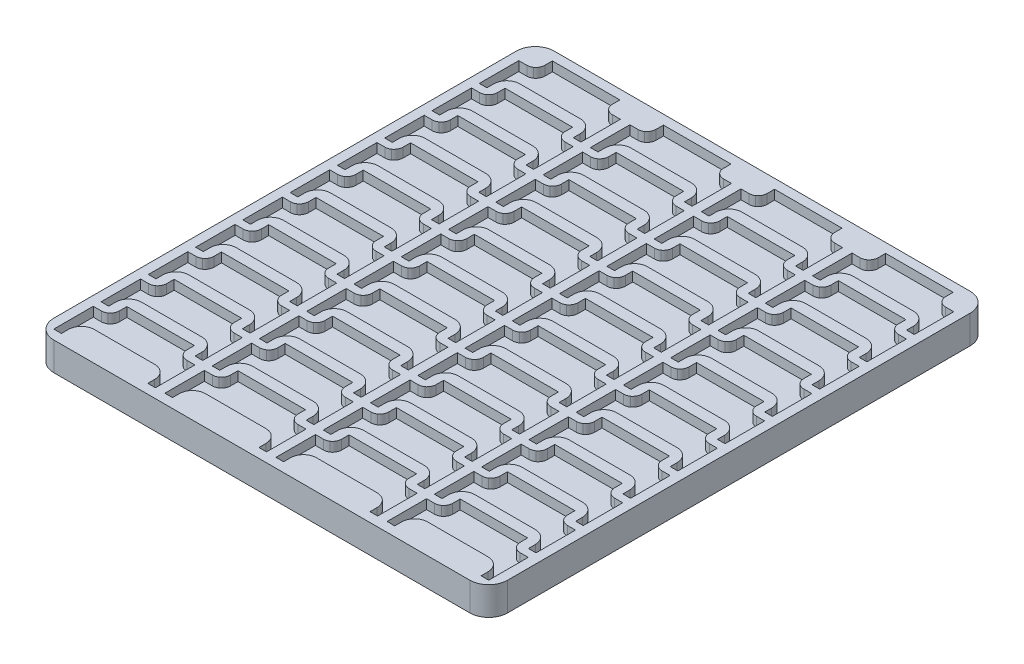
from build123d import *

# Parameters (mm, degrees)
SKETCH1_W           = 96
SKETCH1_H           = 105.85
BOSS_EXTRUDE1_DEPTH = 3
CAVITY1_START       = 1
CAVITY1_DEPTH       = 2
FILLET1_R           = 4


# Read off the part's stored shape, not the designer's step: Cavity1
with BuildPart() as part:
    # Sketch1 → Boss-Extrude1 (new, symmetric)
    with BuildSketch(Plane(origin=(0, 0, 0), x_dir=(1, 0, 0), z_dir=(0, 1, 0))):
        Rectangle(SKETCH1_W, SKETCH1_H)
    extrude(amount=BOSS_EXTRUDE1_DEPTH, both=True)

    # Cavity1 outline → Cavity1 (cut)
    with BuildSketch(Plane(origin=(0, 0, 0), x_dir=(1, 0, 0), z_dir=(0, 1, 0)).offset(CAVITY1_START)):
        with BuildLine():
            Line((5.36, 3.285), (18.14, 3.285))
            ThreePointArc((18.14, 3.285), (20.084543648, 2.479543648), (20.89, 0.535))
            Line((20.89, 0.535), (20.89, -0.925))
            Line((20.89, -0.925), (22.5, -0.925))
            Line((22.5, -0.925), (22.5, 7.428885313))
            Line((22.5, 7.428885313), (20.803324958, 7.428885313))
            ThreePointArc((20.803324958, 7.428885313), (20.233744199, 7.513924788), (19.713842259, 7.761626073))
            ThreePointArc((19.713842259, 7.761626073), (19.108164616, 8.457324711), (18.89, 9.353564747))
            Line((18.89, 9.353564747), (18.89, 10.925))
            Line((18.89, 10.925), (4.61, 10.925))
            Line((4.61, 10.925), (4.61, 9.353564747))
            ThreePointArc((4.61, 9.353564747), (4.391835384, 8.457324711), (3.786157741, 7.761626073))
            ThreePointArc((3.786157741, 7.761626073), (3.266255801, 7.513924788), (2.696675042, 7.428885313))
            Line((2.696675042, 7.428885313), (1, 7.428885313))
            Line((1, 7.428885313), (1, -0.925))
            Line((1, -0.925), (2.61, -0.925))
            Line((2.61, -0.925), (2.61, 0.535))
            ThreePointArc((2.61, 0.535), (3.415456352, 2.479543648), (5.36, 3.285))
        make_face()
        with BuildLine():
            Line((20.89, -39.465), (20.89, -40.925))
            Line((20.89, -40.925), (22.5, -40.925))
            Line((22.5, -40.925), (22.5, -32.571114687))
            Line((22.5, -32.571114687), (20.803324958, -32.571114687))
            ThreePointArc((20.803324958, -32.571114687), (20.233744199, -32.486075212), (19.713842259, -32.238373927))
            ThreePointArc((19.713842259, -32.238373927), (19.108164616, -31.542675289), (18.89, -30.646435253))
            Line((18.89, -30.646435253), (18.89, -29.075))
            Line((18.89, -29.075), (4.61, -29.075))
            Line((4.61, -29.075), (4.61, -30.646435253))
            ThreePointArc((4.61, -30.646435253), (4.391835384, -31.542675289), (3.786157741, -32.238373927))
            ThreePointArc((3.786157741, -32.238373927), (3.266255801, -32.486075212), (2.696675042, -32.571114687))
            Line((2.696675042, -32.571114687), (1, -32.571114687))
            Line((1, -32.571114687), (1, -40.925))
            Line((1, -40.925), (2.61, -40.925))
            Line((2.61, -40.925), (2.61, -39.465))
            ThreePointArc((2.61, -39.465), (3.415456352, -37.520456352), (5.36, -36.715))
            Line((5.36, -36.715), (18.14, -36.715))
            ThreePointArc((18.14, -36.715), (20.084543648, -37.520456352), (20.89, -39.465))
        make_face()
        with BuildLine():
            Line((20.89, -49.465), (20.89, -50.925))
            Line((20.89, -50.925), (22.5, -50.925))
            Line((22.5, -50.925), (22.5, -42.571114687))
            Line((22.5, -42.571114687), (20.803324958, -42.571114687))
            ThreePointArc((20.803324958, -42.571114687), (20.233744199, -42.486075212), (19.713842259, -42.238373927))
            ThreePointArc((19.713842259, -42.238373927), (19.108164616, -41.542675289), (18.89, -40.646435253))
            Line((18.89, -40.646435253), (18.89, -39.075))
            Line((18.89, -39.075), (4.61, -39.075))
            Line((4.61, -39.075), (4.61, -40.646435253))
            ThreePointArc((4.61, -40.646435253), (4.391835384, -41.542675289), (3.786157741, -42.238373927))
            ThreePointArc((3.786157741, -42.238373927), (3.266255801, -42.486075212), (2.696675042, -42.571114687))
            Line((2.696675042, -42.571114687), (1, -42.571114687))
            Line((1, -42.571114687), (1, -50.925))
            Line((1, -50.925), (2.61, -50.925))
            Line((2.61, -50.925), (2.61, -49.465))
            ThreePointArc((2.61, -49.465), (3.415456352, -47.520456352), (5.36, -46.715))
            Line((5.36, -46.715), (18.14, -46.715))
            ThreePointArc((18.14, -46.715), (20.084543648, -47.520456352), (20.89, -49.465))
        make_face()
        with BuildLine():
            Line((20.89, 40.535), (20.89, 39.075))
            Line((20.89, 39.075), (22.5, 39.075))
            Line((22.5, 39.075), (22.5, 47.428885313))
            Line((22.5, 47.428885313), (20.803324958, 47.428885313))
            ThreePointArc((20.803324958, 47.428885313), (20.233744199, 47.513924788), (19.713842259, 47.761626073))
            ThreePointArc((19.713842259, 47.761626073), (19.108164616, 48.457324711), (18.89, 49.353564747))
            Line((18.89, 49.353564747), (18.89, 50.925))
            Line((18.89, 50.925), (4.61, 50.925))
            Line((4.61, 50.925), (4.61, 49.353564747))
            ThreePointArc((4.61, 49.353564747), (4.391835384, 48.457324711), (3.786157741, 47.761626073))
            ThreePointArc((3.786157741, 47.761626073), (3.266255801, 47.513924788), (2.696675042, 47.428885313))
            Line((2.696675042, 47.428885313), (1, 47.428885313))
            Line((1, 47.428885313), (1, 39.075))
            Line((1, 39.075), (2.61, 39.075))
            Line((2.61, 39.075), (2.61, 40.535))
            ThreePointArc((2.61, 40.535), (3.415456352, 42.479543648), (5.36, 43.285))
            Line((5.36, 43.285), (18.14, 43.285))
            ThreePointArc((18.14, 43.285), (20.084543648, 42.479543648), (20.89, 40.535))
        make_face()
        with BuildLine():
            Line((20.89, 10.535), (20.89, 9.075))
            Line((20.89, 9.075), (22.5, 9.075))
            Line((22.5, 9.075), (22.5, 17.428885313))
            Line((22.5, 17.428885313), (20.803324958, 17.428885313))
            ThreePointArc((20.803324958, 17.428885313), (20.233744199, 17.513924788), (19.713842259, 17.761626073))
            ThreePointArc((19.713842259, 17.761626073), (19.108164616, 18.457324711), (18.89, 19.353564747))
            Line((18.89, 19.353564747), (18.89, 20.925))
            Line((18.89, 20.925), (4.61, 20.925))
            Line((4.61, 20.925), (4.61, 19.353564747))
            ThreePointArc((4.61, 19.353564747), (4.391835384, 18.457324711), (3.786157741, 17.761626073))
            ThreePointArc((3.786157741, 17.761626073), (3.266255801, 17.513924788), (2.696675042, 17.428885313))
            Line((2.696675042, 17.428885313), (1, 17.428885313))
            Line((1, 17.428885313), (1, 9.075))
            Line((1, 9.075), (2.61, 9.075))
            Line((2.61, 9.075), (2.61, 10.535))
            ThreePointArc((2.61, 10.535), (3.415456352, 12.479543648), (5.36, 13.285))
            Line((5.36, 13.285), (18.14, 13.285))
            ThreePointArc((18.14, 13.285), (20.084543648, 12.479543648), (20.89, 10.535))
        make_face()
        with BuildLine():
            Line((20.89, -9.465), (20.89, -10.925))
            Line((20.89, -10.925), (22.5, -10.925))
            Line((22.5, -10.925), (22.5, -2.571114687))
            Line((22.5, -2.571114687), (20.803324958, -2.571114687))
            ThreePointArc((20.803324958, -2.571114687), (20.233744199, -2.486075212), (19.713842259, -2.238373927))
            ThreePointArc((19.713842259, -2.238373927), (19.108164616, -1.542675289), (18.89, -0.646435253))
            Line((18.89, -0.646435253), (18.89, 0.925))
            Line((18.89, 0.925), (4.61, 0.925))
            Line((4.61, 0.925), (4.61, -0.646435253))
            ThreePointArc((4.61, -0.646435253), (4.391835384, -1.542675289), (3.786157741, -2.238373927))
            ThreePointArc((3.786157741, -2.238373927), (3.266255801, -2.486075212), (2.696675042, -2.571114687))
            Line((2.696675042, -2.571114687), (1, -2.571114687))
            Line((1, -2.571114687), (1, -10.925))
            Line((1, -10.925), (2.61, -10.925))
            Line((2.61, -10.925), (2.61, -9.465))
            ThreePointArc((2.61, -9.465), (3.415456352, -7.520456352), (5.36, -6.715))
            Line((5.36, -6.715), (18.14, -6.715))
            ThreePointArc((18.14, -6.715), (20.084543648, -7.520456352), (20.89, -9.465))
        make_face()
        with BuildLine():
            Line((20.89, -29.465), (20.89, -30.925))
            Line((20.89, -30.925), (22.5, -30.925))
            Line((22.5, -30.925), (22.5, -22.571114687))
            Line((22.5, -22.571114687), (20.803324958, -22.571114687))
            ThreePointArc((20.803324958, -22.571114687), (20.233744199, -22.486075212), (19.713842259, -22.238373927))
            ThreePointArc((19.713842259, -22.238373927), (19.108164616, -21.542675289), (18.89, -20.646435253))
            Line((18.89, -20.646435253), (18.89, -19.075))
            Line((18.89, -19.075), (4.61, -19.075))
            Line((4.61, -19.075), (4.61, -20.646435253))
            ThreePointArc((4.61, -20.646435253), (4.391835384, -21.542675289), (3.786157741, -22.238373927))
            ThreePointArc((3.786157741, -22.238373927), (3.266255801, -22.486075212), (2.696675042, -22.571114687))
            Line((2.696675042, -22.571114687), (1, -22.571114687))
            Line((1, -22.571114687), (1, -30.925))
            Line((1, -30.925), (2.61, -30.925))
            Line((2.61, -30.925), (2.61, -29.465))
            ThreePointArc((2.61, -29.465), (3.415456352, -27.520456352), (5.36, -26.715))
            Line((5.36, -26.715), (18.14, -26.715))
            ThreePointArc((18.14, -26.715), (20.084543648, -27.520456352), (20.89, -29.465))
        make_face()
        with BuildLine():
            Line((20.89, -19.465), (20.89, -20.925))
            Line((20.89, -20.925), (22.5, -20.925))
            Line((22.5, -20.925), (22.5, -12.571114687))
            Line((22.5, -12.571114687), (20.803324958, -12.571114687))
            ThreePointArc((20.803324958, -12.571114687), (20.233744199, -12.486075212), (19.713842259, -12.238373927))
            ThreePointArc((19.713842259, -12.238373927), (19.108164616, -11.542675289), (18.89, -10.646435253))
            Line((18.89, -10.646435253), (18.89, -9.075))
            Line((18.89, -9.075), (4.61, -9.075))
            Line((4.61, -9.075), (4.61, -10.646435253))
            ThreePointArc((4.61, -10.646435253), (4.391835384, -11.542675289), (3.786157741, -12.238373927))
            ThreePointArc((3.786157741, -12.238373927), (3.266255801, -12.486075212), (2.696675042, -12.571114687))
            Line((2.696675042, -12.571114687), (1, -12.571114687))
            Line((1, -12.571114687), (1, -20.925))
            Line((1, -20.925), (2.61, -20.925))
            Line((2.61, -20.925), (2.61, -19.465))
            ThreePointArc((2.61, -19.465), (3.415456352, -17.520456352), (5.36, -16.715))
            Line((5.36, -16.715), (18.14, -16.715))
            ThreePointArc((18.14, -16.715), (20.084543648, -17.520456352), (20.89, -19.465))
        make_face()
        with BuildLine():
            Line((20.89, 30.535), (20.89, 29.075))
            Line((20.89, 29.075), (22.5, 29.075))
            Line((22.5, 29.075), (22.5, 37.428885313))
            Line((22.5, 37.428885313), (20.803324958, 37.428885313))
            ThreePointArc((20.803324958, 37.428885313), (20.233744199, 37.513924788), (19.713842259, 37.761626073))
            ThreePointArc((19.713842259, 37.761626073), (19.108164616, 38.457324711), (18.89, 39.353564747))
            Line((18.89, 39.353564747), (18.89, 40.925))
            Line((18.89, 40.925), (4.61, 40.925))
            Line((4.61, 40.925), (4.61, 39.353564747))
            ThreePointArc((4.61, 39.353564747), (4.391835384, 38.457324711), (3.786157741, 37.761626073))
            ThreePointArc((3.786157741, 37.761626073), (3.266255801, 37.513924788), (2.696675042, 37.428885313))
            Line((2.696675042, 37.428885313), (1, 37.428885313))
            Line((1, 37.428885313), (1, 29.075))
            Line((1, 29.075), (2.61, 29.075))
            Line((2.61, 29.075), (2.61, 30.535))
            ThreePointArc((2.61, 30.535), (3.415456352, 32.479543648), (5.36, 33.285))
            Line((5.36, 33.285), (18.14, 33.285))
            ThreePointArc((18.14, 33.285), (20.084543648, 32.479543648), (20.89, 30.535))
        make_face()
        with BuildLine():
            Line((20.89, 20.535), (20.89, 19.075))
            Line((20.89, 19.075), (22.5, 19.075))
            Line((22.5, 19.075), (22.5, 27.428885313))
            Line((22.5, 27.428885313), (20.803324958, 27.428885313))
            ThreePointArc((20.803324958, 27.428885313), (20.233744199, 27.513924788), (19.713842259, 27.761626073))
            ThreePointArc((19.713842259, 27.761626073), (19.108164616, 28.457324711), (18.89, 29.353564747))
            Line((18.89, 29.353564747), (18.89, 30.925))
            Line((18.89, 30.925), (4.61, 30.925))
            Line((4.61, 30.925), (4.61, 29.353564747))
            ThreePointArc((4.61, 29.353564747), (4.391835384, 28.457324711), (3.786157741, 27.761626073))
            ThreePointArc((3.786157741, 27.761626073), (3.266255801, 27.513924788), (2.696675042, 27.428885313))
            Line((2.696675042, 27.428885313), (1, 27.428885313))
            Line((1, 27.428885313), (1, 19.075))
            Line((1, 19.075), (2.61, 19.075))
            Line((2.61, 19.075), (2.61, 20.535))
            ThreePointArc((2.61, 20.535), (3.415456352, 22.479543648), (5.36, 23.285))
            Line((5.36, 23.285), (18.14, 23.285))
            ThreePointArc((18.14, 23.285), (20.084543648, 22.479543648), (20.89, 20.535))
        make_face()
        with BuildLine():
            Line((44.39, -0.925), (46, -0.925))
            Line((46, -0.925), (46, 7.428885313))
            Line((46, 7.428885313), (44.303324958, 7.428885313))
            ThreePointArc((44.303324958, 7.428885313), (43.733744199, 7.513924788), (43.213842259, 7.761626073))
            ThreePointArc((43.213842259, 7.761626073), (42.608164616, 8.457324711), (42.39, 9.353564747))
            Line((42.39, 9.353564747), (42.39, 10.925))
            Line((42.39, 10.925), (28.11, 10.925))
            Line((28.11, 10.925), (28.11, 9.353564747))
            ThreePointArc((28.11, 9.353564747), (27.891835384, 8.457324711), (27.286157741, 7.761626073))
            ThreePointArc((27.286157741, 7.761626073), (26.766255801, 7.513924788), (26.196675042, 7.428885313))
            Line((26.196675042, 7.428885313), (24.5, 7.428885313))
            Line((24.5, 7.428885313), (24.5, -0.925))
            Line((24.5, -0.925), (26.11, -0.925))
            Line((26.11, -0.925), (26.11, 0.535))
            ThreePointArc((26.11, 0.535), (26.915456352, 2.479543648), (28.86, 3.285))
            Line((28.86, 3.285), (41.64, 3.285))
            ThreePointArc((41.64, 3.285), (43.584543648, 2.479543648), (44.39, 0.535))
            Line((44.39, 0.535), (44.39, -0.925))
        make_face()
        with BuildLine():
            Line((-26.11, -0.925), (-24.5, -0.925))
            Line((-24.5, -0.925), (-24.5, 7.428885313))
            Line((-24.5, 7.428885313), (-26.196675042, 7.428885313))
            ThreePointArc((-26.196675042, 7.428885313), (-26.766255801, 7.513924788), (-27.286157741, 7.761626073))
            ThreePointArc((-27.286157741, 7.761626073), (-27.891835384, 8.457324711), (-28.11, 9.353564747))
            Line((-28.11, 9.353564747), (-28.11, 10.925))
            Line((-28.11, 10.925), (-42.39, 10.925))
            Line((-42.39, 10.925), (-42.39, 9.353564747))
            ThreePointArc((-42.39, 9.353564747), (-42.608164616, 8.457324711), (-43.213842259, 7.761626073))
            ThreePointArc((-43.213842259, 7.761626073), (-43.733744199, 7.513924788), (-44.303324958, 7.428885313))
            Line((-44.303324958, 7.428885313), (-46, 7.428885313))
            Line((-46, 7.428885313), (-46, -0.925))
            Line((-46, -0.925), (-44.39, -0.925))
            Line((-44.39, -0.925), (-44.39, 0.535))
            ThreePointArc((-44.39, 0.535), (-43.584543648, 2.479543648), (-41.64, 3.285))
            Line((-41.64, 3.285), (-28.86, 3.285))
            ThreePointArc((-28.86, 3.285), (-26.915456352, 2.479543648), (-26.11, 0.535))
            Line((-26.11, 0.535), (-26.11, -0.925))
        make_face()
        with BuildLine():
            Line((-2.61, -0.925), (-1, -0.925))
            Line((-1, -0.925), (-1, 7.428885313))
            Line((-1, 7.428885313), (-2.696675042, 7.428885313))
            ThreePointArc((-2.696675042, 7.428885313), (-3.266255801, 7.513924788), (-3.786157741, 7.761626073))
            ThreePointArc((-3.786157741, 7.761626073), (-4.391835384, 8.457324711), (-4.61, 9.353564747))
            Line((-4.61, 9.353564747), (-4.61, 10.925))
            Line((-4.61, 10.925), (-18.89, 10.925))
            Line((-18.89, 10.925), (-18.89, 9.353564747))
            ThreePointArc((-18.89, 9.353564747), (-19.108164616, 8.457324711), (-19.713842259, 7.761626073))
            ThreePointArc((-19.713842259, 7.761626073), (-20.233744199, 7.513924788), (-20.803324958, 7.428885313))
            Line((-20.803324958, 7.428885313), (-22.5, 7.428885313))
            Line((-22.5, 7.428885313), (-22.5, -0.925))
            Line((-22.5, -0.925), (-20.89, -0.925))
            Line((-20.89, -0.925), (-20.89, 0.535))
            ThreePointArc((-20.89, 0.535), (-20.084543648, 2.479543648), (-18.14, 3.285))
            Line((-18.14, 3.285), (-5.36, 3.285))
            ThreePointArc((-5.36, 3.285), (-3.415456352, 2.479543648), (-2.61, 0.535))
            Line((-2.61, 0.535), (-2.61, -0.925))
        make_face()
        with BuildLine():
            Line((-26.11, -40.925), (-24.5, -40.925))
            Line((-24.5, -40.925), (-24.5, -32.571114687))
            Line((-24.5, -32.571114687), (-26.196675042, -32.571114687))
            ThreePointArc((-26.196675042, -32.571114687), (-26.766255801, -32.486075212), (-27.286157741, -32.238373927))
            ThreePointArc((-27.286157741, -32.238373927), (-27.891835384, -31.542675289), (-28.11, -30.646435253))
            Line((-28.11, -30.646435253), (-28.11, -29.075))
            Line((-28.11, -29.075), (-42.39, -29.075))
            Line((-42.39, -29.075), (-42.39, -30.646435253))
            ThreePointArc((-42.39, -30.646435253), (-42.608164616, -31.542675289), (-43.213842259, -32.238373927))
            ThreePointArc((-43.213842259, -32.238373927), (-43.733744199, -32.486075212), (-44.303324958, -32.571114687))
            Line((-44.303324958, -32.571114687), (-46, -32.571114687))
            Line((-46, -32.571114687), (-46, -40.925))
            Line((-46, -40.925), (-44.39, -40.925))
            Line((-44.39, -40.925), (-44.39, -39.465))
            ThreePointArc((-44.39, -39.465), (-43.584543648, -37.520456352), (-41.64, -36.715))
            Line((-41.64, -36.715), (-28.86, -36.715))
            ThreePointArc((-28.86, -36.715), (-26.915456352, -37.520456352), (-26.11, -39.465))
            Line((-26.11, -39.465), (-26.11, -40.925))
        make_face()
        with BuildLine():
            Line((-2.61, -40.925), (-1, -40.925))
            Line((-1, -40.925), (-1, -32.571114687))
            Line((-1, -32.571114687), (-2.696675042, -32.571114687))
            ThreePointArc((-2.696675042, -32.571114687), (-3.266255801, -32.486075212), (-3.786157741, -32.238373927))
            ThreePointArc((-3.786157741, -32.238373927), (-4.391835384, -31.542675289), (-4.61, -30.646435253))
            Line((-4.61, -30.646435253), (-4.61, -29.075))
            Line((-4.61, -29.075), (-18.89, -29.075))
            Line((-18.89, -29.075), (-18.89, -30.646435253))
            ThreePointArc((-18.89, -30.646435253), (-19.108164616, -31.542675289), (-19.713842259, -32.238373927))
            ThreePointArc((-19.713842259, -32.238373927), (-20.233744199, -32.486075212), (-20.803324958, -32.571114687))
            Line((-20.803324958, -32.571114687), (-22.5, -32.571114687))
            Line((-22.5, -32.571114687), (-22.5, -40.925))
            Line((-22.5, -40.925), (-20.89, -40.925))
            Line((-20.89, -40.925), (-20.89, -39.465))
            ThreePointArc((-20.89, -39.465), (-20.084543648, -37.520456352), (-18.14, -36.715))
            Line((-18.14, -36.715), (-5.36, -36.715))
            ThreePointArc((-5.36, -36.715), (-3.415456352, -37.520456352), (-2.61, -39.465))
            Line((-2.61, -39.465), (-2.61, -40.925))
        make_face()
        with BuildLine():
            Line((44.39, -40.925), (46, -40.925))
            Line((46, -40.925), (46, -32.571114687))
            Line((46, -32.571114687), (44.303324958, -32.571114687))
            ThreePointArc((44.303324958, -32.571114687), (43.733744199, -32.486075212), (43.213842259, -32.238373927))
            ThreePointArc((43.213842259, -32.238373927), (42.608164616, -31.542675289), (42.39, -30.646435253))
            Line((42.39, -30.646435253), (42.39, -29.075))
            Line((42.39, -29.075), (28.11, -29.075))
            Line((28.11, -29.075), (28.11, -30.646435253))
            ThreePointArc((28.11, -30.646435253), (27.891835384, -31.542675289), (27.286157741, -32.238373927))
            ThreePointArc((27.286157741, -32.238373927), (26.766255801, -32.486075212), (26.196675042, -32.571114687))
            Line((26.196675042, -32.571114687), (24.5, -32.571114687))
            Line((24.5, -32.571114687), (24.5, -40.925))
            Line((24.5, -40.925), (26.11, -40.925))
            Line((26.11, -40.925), (26.11, -39.465))
            ThreePointArc((26.11, -39.465), (26.915456352, -37.520456352), (28.86, -36.715))
            Line((28.86, -36.715), (41.64, -36.715))
            ThreePointArc((41.64, -36.715), (43.584543648, -37.520456352), (44.39, -39.465))
            Line((44.39, -39.465), (44.39, -40.925))
        make_face()
        with BuildLine():
            Line((-26.11, -50.925), (-24.5, -50.925))
            Line((-24.5, -50.925), (-24.5, -42.571114687))
            Line((-24.5, -42.571114687), (-26.196675042, -42.571114687))
            ThreePointArc((-26.196675042, -42.571114687), (-26.766255801, -42.486075212), (-27.286157741, -42.238373927))
            ThreePointArc((-27.286157741, -42.238373927), (-27.891835384, -41.542675289), (-28.11, -40.646435253))
            Line((-28.11, -40.646435253), (-28.11, -39.075))
            Line((-28.11, -39.075), (-42.39, -39.075))
            Line((-42.39, -39.075), (-42.39, -40.646435253))
            ThreePointArc((-42.39, -40.646435253), (-42.608164616, -41.542675289), (-43.213842259, -42.238373927))
            ThreePointArc((-43.213842259, -42.238373927), (-43.733744199, -42.486075212), (-44.303324958, -42.571114687))
            Line((-44.303324958, -42.571114687), (-46, -42.571114687))
            Line((-46, -42.571114687), (-46, -50.925))
            Line((-46, -50.925), (-44.39, -50.925))
            Line((-44.39, -50.925), (-44.39, -49.465))
            ThreePointArc((-44.39, -49.465), (-43.584543648, -47.520456352), (-41.64, -46.715))
            Line((-41.64, -46.715), (-28.86, -46.715))
            ThreePointArc((-28.86, -46.715), (-26.915456352, -47.520456352), (-26.11, -49.465))
            Line((-26.11, -49.465), (-26.11, -50.925))
        make_face()
        with BuildLine():
            Line((-2.61, -50.925), (-1, -50.925))
            Line((-1, -50.925), (-1, -42.571114687))
            Line((-1, -42.571114687), (-2.696675042, -42.571114687))
            ThreePointArc((-2.696675042, -42.571114687), (-3.266255801, -42.486075212), (-3.786157741, -42.238373927))
            ThreePointArc((-3.786157741, -42.238373927), (-4.391835384, -41.542675289), (-4.61, -40.646435253))
            Line((-4.61, -40.646435253), (-4.61, -39.075))
            Line((-4.61, -39.075), (-18.89, -39.075))
            Line((-18.89, -39.075), (-18.89, -40.646435253))
            ThreePointArc((-18.89, -40.646435253), (-19.108164616, -41.542675289), (-19.713842259, -42.238373927))
            ThreePointArc((-19.713842259, -42.238373927), (-20.233744199, -42.486075212), (-20.803324958, -42.571114687))
            Line((-20.803324958, -42.571114687), (-22.5, -42.571114687))
            Line((-22.5, -42.571114687), (-22.5, -50.925))
            Line((-22.5, -50.925), (-20.89, -50.925))
            Line((-20.89, -50.925), (-20.89, -49.465))
            ThreePointArc((-20.89, -49.465), (-20.084543648, -47.520456352), (-18.14, -46.715))
            Line((-18.14, -46.715), (-5.36, -46.715))
            ThreePointArc((-5.36, -46.715), (-3.415456352, -47.520456352), (-2.61, -49.465))
            Line((-2.61, -49.465), (-2.61, -50.925))
        make_face()
        with BuildLine():
            Line((44.39, -50.925), (46, -50.925))
            Line((46, -50.925), (46, -42.571114687))
            Line((46, -42.571114687), (44.303324958, -42.571114687))
            ThreePointArc((44.303324958, -42.571114687), (43.733744199, -42.486075212), (43.213842259, -42.238373927))
            ThreePointArc((43.213842259, -42.238373927), (42.608164616, -41.542675289), (42.39, -40.646435253))
            Line((42.39, -40.646435253), (42.39, -39.075))
            Line((42.39, -39.075), (28.11, -39.075))
            Line((28.11, -39.075), (28.11, -40.646435253))
            ThreePointArc((28.11, -40.646435253), (27.891835384, -41.542675289), (27.286157741, -42.238373927))
            ThreePointArc((27.286157741, -42.238373927), (26.766255801, -42.486075212), (26.196675042, -42.571114687))
            Line((26.196675042, -42.571114687), (24.5, -42.571114687))
            Line((24.5, -42.571114687), (24.5, -50.925))
            Line((24.5, -50.925), (26.11, -50.925))
            Line((26.11, -50.925), (26.11, -49.465))
            ThreePointArc((26.11, -49.465), (26.915456352, -47.520456352), (28.86, -46.715))
            Line((28.86, -46.715), (41.64, -46.715))
            ThreePointArc((41.64, -46.715), (43.584543648, -47.520456352), (44.39, -49.465))
            Line((44.39, -49.465), (44.39, -50.925))
        make_face()
        with BuildLine():
            Line((-18.14, -6.715), (-5.36, -6.715))
            ThreePointArc((-5.36, -6.715), (-3.415456352, -7.520456352), (-2.61, -9.465))
            Line((-2.61, -9.465), (-2.61, -10.925))
            Line((-2.61, -10.925), (-1, -10.925))
            Line((-1, -10.925), (-1, -2.571114687))
            Line((-1, -2.571114687), (-2.696675042, -2.571114687))
            ThreePointArc((-2.696675042, -2.571114687), (-3.266255801, -2.486075212), (-3.786157741, -2.238373927))
            ThreePointArc((-3.786157741, -2.238373927), (-4.391835384, -1.542675289), (-4.61, -0.646435253))
            Line((-4.61, -0.646435253), (-4.61, 0.925))
            Line((-4.61, 0.925), (-18.89, 0.925))
            Line((-18.89, 0.925), (-18.89, -0.646435253))
            ThreePointArc((-18.89, -0.646435253), (-19.108164616, -1.542675289), (-19.713842259, -2.238373927))
            ThreePointArc((-19.713842259, -2.238373927), (-20.233744199, -2.486075212), (-20.803324958, -2.571114687))
            Line((-20.803324958, -2.571114687), (-22.5, -2.571114687))
            Line((-22.5, -2.571114687), (-22.5, -10.925))
            Line((-22.5, -10.925), (-20.89, -10.925))
            Line((-20.89, -10.925), (-20.89, -9.465))
            ThreePointArc((-20.89, -9.465), (-20.084543648, -7.520456352), (-18.14, -6.715))
        make_face()
        with BuildLine():
            Line((-2.61, 40.535), (-2.61, 39.075))
            Line((-2.61, 39.075), (-1, 39.075))
            Line((-1, 39.075), (-1, 47.428885313))
            Line((-1, 47.428885313), (-2.696675042, 47.428885313))
            ThreePointArc((-2.696675042, 47.428885313), (-3.266255801, 47.513924788), (-3.786157741, 47.761626073))
            ThreePointArc((-3.786157741, 47.761626073), (-4.391835384, 48.457324711), (-4.61, 49.353564747))
            Line((-4.61, 49.353564747), (-4.61, 50.925))
            Line((-4.61, 50.925), (-18.89, 50.925))
            Line((-18.89, 50.925), (-18.89, 49.353564747))
            ThreePointArc((-18.89, 49.353564747), (-19.108164616, 48.457324711), (-19.713842259, 47.761626073))
            ThreePointArc((-19.713842259, 47.761626073), (-20.233744199, 47.513924788), (-20.803324958, 47.428885313))
            Line((-20.803324958, 47.428885313), (-22.5, 47.428885313))
            Line((-22.5, 47.428885313), (-22.5, 39.075))
            Line((-22.5, 39.075), (-20.89, 39.075))
            Line((-20.89, 39.075), (-20.89, 40.535))
            ThreePointArc((-20.89, 40.535), (-20.084543648, 42.479543648), (-18.14, 43.285))
            Line((-18.14, 43.285), (-5.36, 43.285))
            ThreePointArc((-5.36, 43.285), (-3.415456352, 42.479543648), (-2.61, 40.535))
        make_face()
        with BuildLine():
            Line((-2.61, 10.535), (-2.61, 9.075))
            Line((-2.61, 9.075), (-1, 9.075))
            Line((-1, 9.075), (-1, 17.428885313))
            Line((-1, 17.428885313), (-2.696675042, 17.428885313))
            ThreePointArc((-2.696675042, 17.428885313), (-3.266255801, 17.513924788), (-3.786157741, 17.761626073))
            ThreePointArc((-3.786157741, 17.761626073), (-4.391835384, 18.457324711), (-4.61, 19.353564747))
            Line((-4.61, 19.353564747), (-4.61, 20.925))
            Line((-4.61, 20.925), (-18.89, 20.925))
            Line((-18.89, 20.925), (-18.89, 19.353564747))
            ThreePointArc((-18.89, 19.353564747), (-19.108164616, 18.457324711), (-19.713842259, 17.761626073))
            ThreePointArc((-19.713842259, 17.761626073), (-20.233744199, 17.513924788), (-20.803324958, 17.428885313))
            Line((-20.803324958, 17.428885313), (-22.5, 17.428885313))
            Line((-22.5, 17.428885313), (-22.5, 9.075))
            Line((-22.5, 9.075), (-20.89, 9.075))
            Line((-20.89, 9.075), (-20.89, 10.535))
            ThreePointArc((-20.89, 10.535), (-20.084543648, 12.479543648), (-18.14, 13.285))
            Line((-18.14, 13.285), (-5.36, 13.285))
            ThreePointArc((-5.36, 13.285), (-3.415456352, 12.479543648), (-2.61, 10.535))
        make_face()
        with BuildLine():
            Line((-2.61, -29.465), (-2.61, -30.925))
            Line((-2.61, -30.925), (-1, -30.925))
            Line((-1, -30.925), (-1, -22.571114687))
            Line((-1, -22.571114687), (-2.696675042, -22.571114687))
            ThreePointArc((-2.696675042, -22.571114687), (-3.266255801, -22.486075212), (-3.786157741, -22.238373927))
            ThreePointArc((-3.786157741, -22.238373927), (-4.391835384, -21.542675289), (-4.61, -20.646435253))
            Line((-4.61, -20.646435253), (-4.61, -19.075))
            Line((-4.61, -19.075), (-18.89, -19.075))
            Line((-18.89, -19.075), (-18.89, -20.646435253))
            ThreePointArc((-18.89, -20.646435253), (-19.108164616, -21.542675289), (-19.713842259, -22.238373927))
            ThreePointArc((-19.713842259, -22.238373927), (-20.233744199, -22.486075212), (-20.803324958, -22.571114687))
            Line((-20.803324958, -22.571114687), (-22.5, -22.571114687))
            Line((-22.5, -22.571114687), (-22.5, -30.925))
            Line((-22.5, -30.925), (-20.89, -30.925))
            Line((-20.89, -30.925), (-20.89, -29.465))
            ThreePointArc((-20.89, -29.465), (-20.084543648, -27.520456352), (-18.14, -26.715))
            Line((-18.14, -26.715), (-5.36, -26.715))
            ThreePointArc((-5.36, -26.715), (-3.415456352, -27.520456352), (-2.61, -29.465))
        make_face()
        with BuildLine():
            Line((-2.61, -19.465), (-2.61, -20.925))
            Line((-2.61, -20.925), (-1, -20.925))
            Line((-1, -20.925), (-1, -12.571114687))
            Line((-1, -12.571114687), (-2.696675042, -12.571114687))
            ThreePointArc((-2.696675042, -12.571114687), (-3.266255801, -12.486075212), (-3.786157741, -12.238373927))
            ThreePointArc((-3.786157741, -12.238373927), (-4.391835384, -11.542675289), (-4.61, -10.646435253))
            Line((-4.61, -10.646435253), (-4.61, -9.075))
            Line((-4.61, -9.075), (-18.89, -9.075))
            Line((-18.89, -9.075), (-18.89, -10.646435253))
            ThreePointArc((-18.89, -10.646435253), (-19.108164616, -11.542675289), (-19.713842259, -12.238373927))
            ThreePointArc((-19.713842259, -12.238373927), (-20.233744199, -12.486075212), (-20.803324958, -12.571114687))
            Line((-20.803324958, -12.571114687), (-22.5, -12.571114687))
            Line((-22.5, -12.571114687), (-22.5, -20.925))
            Line((-22.5, -20.925), (-20.89, -20.925))
            Line((-20.89, -20.925), (-20.89, -19.465))
            ThreePointArc((-20.89, -19.465), (-20.084543648, -17.520456352), (-18.14, -16.715))
            Line((-18.14, -16.715), (-5.36, -16.715))
            ThreePointArc((-5.36, -16.715), (-3.415456352, -17.520456352), (-2.61, -19.465))
        make_face()
        with BuildLine():
            Line((-2.61, 30.535), (-2.61, 29.075))
            Line((-2.61, 29.075), (-1, 29.075))
            Line((-1, 29.075), (-1, 37.428885313))
            Line((-1, 37.428885313), (-2.696675042, 37.428885313))
            ThreePointArc((-2.696675042, 37.428885313), (-3.266255801, 37.513924788), (-3.786157741, 37.761626073))
            ThreePointArc((-3.786157741, 37.761626073), (-4.391835384, 38.457324711), (-4.61, 39.353564747))
            Line((-4.61, 39.353564747), (-4.61, 40.925))
            Line((-4.61, 40.925), (-18.89, 40.925))
            Line((-18.89, 40.925), (-18.89, 39.353564747))
            ThreePointArc((-18.89, 39.353564747), (-19.108164616, 38.457324711), (-19.713842259, 37.761626073))
            ThreePointArc((-19.713842259, 37.761626073), (-20.233744199, 37.513924788), (-20.803324958, 37.428885313))
            Line((-20.803324958, 37.428885313), (-22.5, 37.428885313))
            Line((-22.5, 37.428885313), (-22.5, 29.075))
            Line((-22.5, 29.075), (-20.89, 29.075))
            Line((-20.89, 29.075), (-20.89, 30.535))
            ThreePointArc((-20.89, 30.535), (-20.084543648, 32.479543648), (-18.14, 33.285))
            Line((-18.14, 33.285), (-5.36, 33.285))
            ThreePointArc((-5.36, 33.285), (-3.415456352, 32.479543648), (-2.61, 30.535))
        make_face()
        with BuildLine():
            Line((-2.61, 20.535), (-2.61, 19.075))
            Line((-2.61, 19.075), (-1, 19.075))
            Line((-1, 19.075), (-1, 27.428885313))
            Line((-1, 27.428885313), (-2.696675042, 27.428885313))
            ThreePointArc((-2.696675042, 27.428885313), (-3.266255801, 27.513924788), (-3.786157741, 27.761626073))
            ThreePointArc((-3.786157741, 27.761626073), (-4.391835384, 28.457324711), (-4.61, 29.353564747))
            Line((-4.61, 29.353564747), (-4.61, 30.925))
            Line((-4.61, 30.925), (-18.89, 30.925))
            Line((-18.89, 30.925), (-18.89, 29.353564747))
            ThreePointArc((-18.89, 29.353564747), (-19.108164616, 28.457324711), (-19.713842259, 27.761626073))
            ThreePointArc((-19.713842259, 27.761626073), (-20.233744199, 27.513924788), (-20.803324958, 27.428885313))
            Line((-20.803324958, 27.428885313), (-22.5, 27.428885313))
            Line((-22.5, 27.428885313), (-22.5, 19.075))
            Line((-22.5, 19.075), (-20.89, 19.075))
            Line((-20.89, 19.075), (-20.89, 20.535))
            ThreePointArc((-20.89, 20.535), (-20.084543648, 22.479543648), (-18.14, 23.285))
            Line((-18.14, 23.285), (-5.36, 23.285))
            ThreePointArc((-5.36, 23.285), (-3.415456352, 22.479543648), (-2.61, 20.535))
        make_face()
        with BuildLine():
            Line((44.39, -10.925), (46, -10.925))
            Line((46, -10.925), (46, -2.571114687))
            Line((46, -2.571114687), (44.303324958, -2.571114687))
            ThreePointArc((44.303324958, -2.571114687), (43.733744199, -2.486075212), (43.213842259, -2.238373927))
            ThreePointArc((43.213842259, -2.238373927), (42.608164616, -1.542675289), (42.39, -0.646435253))
            Line((42.39, -0.646435253), (42.39, 0.925))
            Line((42.39, 0.925), (28.11, 0.925))
            Line((28.11, 0.925), (28.11, -0.646435253))
            ThreePointArc((28.11, -0.646435253), (27.891835384, -1.542675289), (27.286157741, -2.238373927))
            ThreePointArc((27.286157741, -2.238373927), (26.766255801, -2.486075212), (26.196675042, -2.571114687))
            Line((26.196675042, -2.571114687), (24.5, -2.571114687))
            Line((24.5, -2.571114687), (24.5, -10.925))
            Line((24.5, -10.925), (26.11, -10.925))
            Line((26.11, -10.925), (26.11, -9.465))
            ThreePointArc((26.11, -9.465), (26.915456352, -7.520456352), (28.86, -6.715))
            Line((28.86, -6.715), (41.64, -6.715))
            ThreePointArc((41.64, -6.715), (43.584543648, -7.520456352), (44.39, -9.465))
            Line((44.39, -9.465), (44.39, -10.925))
        make_face()
        with BuildLine():
            Line((-26.11, -10.925), (-24.5, -10.925))
            Line((-24.5, -10.925), (-24.5, -2.571114687))
            Line((-24.5, -2.571114687), (-26.196675042, -2.571114687))
            ThreePointArc((-26.196675042, -2.571114687), (-26.766255801, -2.486075212), (-27.286157741, -2.238373927))
            ThreePointArc((-27.286157741, -2.238373927), (-27.891835384, -1.542675289), (-28.11, -0.646435253))
            Line((-28.11, -0.646435253), (-28.11, 0.925))
            Line((-28.11, 0.925), (-42.39, 0.925))
            Line((-42.39, 0.925), (-42.39, -0.646435253))
            ThreePointArc((-42.39, -0.646435253), (-42.608164616, -1.542675289), (-43.213842259, -2.238373927))
            ThreePointArc((-43.213842259, -2.238373927), (-43.733744199, -2.486075212), (-44.303324958, -2.571114687))
            Line((-44.303324958, -2.571114687), (-46, -2.571114687))
            Line((-46, -2.571114687), (-46, -10.925))
            Line((-46, -10.925), (-44.39, -10.925))
            Line((-44.39, -10.925), (-44.39, -9.465))
            ThreePointArc((-44.39, -9.465), (-43.584543648, -7.520456352), (-41.64, -6.715))
            Line((-41.64, -6.715), (-28.86, -6.715))
            ThreePointArc((-28.86, -6.715), (-26.915456352, -7.520456352), (-26.11, -9.465))
            Line((-26.11, -9.465), (-26.11, -10.925))
        make_face()
        with BuildLine():
            Line((-41.64, 43.285), (-28.86, 43.285))
            ThreePointArc((-28.86, 43.285), (-26.915456352, 42.479543648), (-26.11, 40.535))
            Line((-26.11, 40.535), (-26.11, 39.075))
            Line((-26.11, 39.075), (-24.5, 39.075))
            Line((-24.5, 39.075), (-24.5, 47.428885313))
            Line((-24.5, 47.428885313), (-26.196675042, 47.428885313))
            ThreePointArc((-26.196675042, 47.428885313), (-26.766255801, 47.513924788), (-27.286157741, 47.761626073))
            ThreePointArc((-27.286157741, 47.761626073), (-27.891835384, 48.457324711), (-28.11, 49.353564747))
            Line((-28.11, 49.353564747), (-28.11, 50.925))
            Line((-28.11, 50.925), (-42.39, 50.925))
            Line((-42.39, 50.925), (-42.39, 49.353564747))
            ThreePointArc((-42.39, 49.353564747), (-42.608164616, 48.457324711), (-43.213842259, 47.761626073))
            ThreePointArc((-43.213842259, 47.761626073), (-43.733744199, 47.513924788), (-44.303324958, 47.428885313))
            Line((-44.303324958, 47.428885313), (-46, 47.428885313))
            Line((-46, 47.428885313), (-46, 39.075))
            Line((-46, 39.075), (-44.39, 39.075))
            Line((-44.39, 39.075), (-44.39, 40.535))
            ThreePointArc((-44.39, 40.535), (-43.584543648, 42.479543648), (-41.64, 43.285))
        make_face()
        with BuildLine():
            Line((-26.11, 10.535), (-26.11, 9.075))
            Line((-26.11, 9.075), (-24.5, 9.075))
            Line((-24.5, 9.075), (-24.5, 17.428885313))
            Line((-24.5, 17.428885313), (-26.196675042, 17.428885313))
            ThreePointArc((-26.196675042, 17.428885313), (-26.766255801, 17.513924788), (-27.286157741, 17.761626073))
            ThreePointArc((-27.286157741, 17.761626073), (-27.891835384, 18.457324711), (-28.11, 19.353564747))
            Line((-28.11, 19.353564747), (-28.11, 20.925))
            Line((-28.11, 20.925), (-42.39, 20.925))
            Line((-42.39, 20.925), (-42.39, 19.353564747))
            ThreePointArc((-42.39, 19.353564747), (-42.608164616, 18.457324711), (-43.213842259, 17.761626073))
            ThreePointArc((-43.213842259, 17.761626073), (-43.733744199, 17.513924788), (-44.303324958, 17.428885313))
            Line((-44.303324958, 17.428885313), (-46, 17.428885313))
            Line((-46, 17.428885313), (-46, 9.075))
            Line((-46, 9.075), (-44.39, 9.075))
            Line((-44.39, 9.075), (-44.39, 10.535))
            ThreePointArc((-44.39, 10.535), (-43.584543648, 12.479543648), (-41.64, 13.285))
            Line((-41.64, 13.285), (-28.86, 13.285))
            ThreePointArc((-28.86, 13.285), (-26.915456352, 12.479543648), (-26.11, 10.535))
        make_face()
        with BuildLine():
            Line((-26.11, -29.465), (-26.11, -30.925))
            Line((-26.11, -30.925), (-24.5, -30.925))
            Line((-24.5, -30.925), (-24.5, -22.571114687))
            Line((-24.5, -22.571114687), (-26.196675042, -22.571114687))
            ThreePointArc((-26.196675042, -22.571114687), (-26.766255801, -22.486075212), (-27.286157741, -22.238373927))
            ThreePointArc((-27.286157741, -22.238373927), (-27.891835384, -21.542675289), (-28.11, -20.646435253))
            Line((-28.11, -20.646435253), (-28.11, -19.075))
            Line((-28.11, -19.075), (-42.39, -19.075))
            Line((-42.39, -19.075), (-42.39, -20.646435253))
            ThreePointArc((-42.39, -20.646435253), (-42.608164616, -21.542675289), (-43.213842259, -22.238373927))
            ThreePointArc((-43.213842259, -22.238373927), (-43.733744199, -22.486075212), (-44.303324958, -22.571114687))
            Line((-44.303324958, -22.571114687), (-46, -22.571114687))
            Line((-46, -22.571114687), (-46, -30.925))
            Line((-46, -30.925), (-44.39, -30.925))
            Line((-44.39, -30.925), (-44.39, -29.465))
            ThreePointArc((-44.39, -29.465), (-43.584543648, -27.520456352), (-41.64, -26.715))
            Line((-41.64, -26.715), (-28.86, -26.715))
            ThreePointArc((-28.86, -26.715), (-26.915456352, -27.520456352), (-26.11, -29.465))
        make_face()
        with BuildLine():
            Line((-26.11, 30.535), (-26.11, 29.075))
            Line((-26.11, 29.075), (-24.5, 29.075))
            Line((-24.5, 29.075), (-24.5, 37.428885313))
            Line((-24.5, 37.428885313), (-26.196675042, 37.428885313))
            ThreePointArc((-26.196675042, 37.428885313), (-26.766255801, 37.513924788), (-27.286157741, 37.761626073))
            ThreePointArc((-27.286157741, 37.761626073), (-27.891835384, 38.457324711), (-28.11, 39.353564747))
            Line((-28.11, 39.353564747), (-28.11, 40.925))
            Line((-28.11, 40.925), (-42.39, 40.925))
            Line((-42.39, 40.925), (-42.39, 39.353564747))
            ThreePointArc((-42.39, 39.353564747), (-42.608164616, 38.457324711), (-43.213842259, 37.761626073))
            ThreePointArc((-43.213842259, 37.761626073), (-43.733744199, 37.513924788), (-44.303324958, 37.428885313))
            Line((-44.303324958, 37.428885313), (-46, 37.428885313))
            Line((-46, 37.428885313), (-46, 29.075))
            Line((-46, 29.075), (-44.39, 29.075))
            Line((-44.39, 29.075), (-44.39, 30.535))
            ThreePointArc((-44.39, 30.535), (-43.584543648, 32.479543648), (-41.64, 33.285))
            Line((-41.64, 33.285), (-28.86, 33.285))
            ThreePointArc((-28.86, 33.285), (-26.915456352, 32.479543648), (-26.11, 30.535))
        make_face()
        with BuildLine():
            Line((-26.11, 20.535), (-26.11, 19.075))
            Line((-26.11, 19.075), (-24.5, 19.075))
            Line((-24.5, 19.075), (-24.5, 27.428885313))
            Line((-24.5, 27.428885313), (-26.196675042, 27.428885313))
            ThreePointArc((-26.196675042, 27.428885313), (-26.766255801, 27.513924788), (-27.286157741, 27.761626073))
            ThreePointArc((-27.286157741, 27.761626073), (-27.891835384, 28.457324711), (-28.11, 29.353564747))
            Line((-28.11, 29.353564747), (-28.11, 30.925))
            Line((-28.11, 30.925), (-42.39, 30.925))
            Line((-42.39, 30.925), (-42.39, 29.353564747))
            ThreePointArc((-42.39, 29.353564747), (-42.608164616, 28.457324711), (-43.213842259, 27.761626073))
            ThreePointArc((-43.213842259, 27.761626073), (-43.733744199, 27.513924788), (-44.303324958, 27.428885313))
            Line((-44.303324958, 27.428885313), (-46, 27.428885313))
            Line((-46, 27.428885313), (-46, 19.075))
            Line((-46, 19.075), (-44.39, 19.075))
            Line((-44.39, 19.075), (-44.39, 20.535))
            ThreePointArc((-44.39, 20.535), (-43.584543648, 22.479543648), (-41.64, 23.285))
            Line((-41.64, 23.285), (-28.86, 23.285))
            ThreePointArc((-28.86, 23.285), (-26.915456352, 22.479543648), (-26.11, 20.535))
        make_face()
        with BuildLine():
            Line((-26.11, -19.465), (-26.11, -20.925))
            Line((-26.11, -20.925), (-24.5, -20.925))
            Line((-24.5, -20.925), (-24.5, -12.571114687))
            Line((-24.5, -12.571114687), (-26.196675042, -12.571114687))
            ThreePointArc((-26.196675042, -12.571114687), (-26.766255801, -12.486075212), (-27.286157741, -12.238373927))
            ThreePointArc((-27.286157741, -12.238373927), (-27.891835384, -11.542675289), (-28.11, -10.646435253))
            Line((-28.11, -10.646435253), (-28.11, -9.075))
            Line((-28.11, -9.075), (-42.39, -9.075))
            Line((-42.39, -9.075), (-42.39, -10.646435253))
            ThreePointArc((-42.39, -10.646435253), (-42.608164616, -11.542675289), (-43.213842259, -12.238373927))
            ThreePointArc((-43.213842259, -12.238373927), (-43.733744199, -12.486075212), (-44.303324958, -12.571114687))
            Line((-44.303324958, -12.571114687), (-46, -12.571114687))
            Line((-46, -12.571114687), (-46, -20.925))
            Line((-46, -20.925), (-44.39, -20.925))
            Line((-44.39, -20.925), (-44.39, -19.465))
            ThreePointArc((-44.39, -19.465), (-43.584543648, -17.520456352), (-41.64, -16.715))
            Line((-41.64, -16.715), (-28.86, -16.715))
            ThreePointArc((-28.86, -16.715), (-26.915456352, -17.520456352), (-26.11, -19.465))
        make_face()
        with BuildLine():
            Line((44.39, 39.075), (46, 39.075))
            Line((46, 39.075), (46, 47.428885313))
            Line((46, 47.428885313), (44.303324958, 47.428885313))
            ThreePointArc((44.303324958, 47.428885313), (43.733744199, 47.513924788), (43.213842259, 47.761626073))
            ThreePointArc((43.213842259, 47.761626073), (42.608164616, 48.457324711), (42.39, 49.353564747))
            Line((42.39, 49.353564747), (42.39, 50.925))
            Line((42.39, 50.925), (28.11, 50.925))
            Line((28.11, 50.925), (28.11, 49.353564747))
            ThreePointArc((28.11, 49.353564747), (27.891835384, 48.457324711), (27.286157741, 47.761626073))
            ThreePointArc((27.286157741, 47.761626073), (26.766255801, 47.513924788), (26.196675042, 47.428885313))
            Line((26.196675042, 47.428885313), (24.5, 47.428885313))
            Line((24.5, 47.428885313), (24.5, 39.075))
            Line((24.5, 39.075), (26.11, 39.075))
            Line((26.11, 39.075), (26.11, 40.535))
            ThreePointArc((26.11, 40.535), (26.915456352, 42.479543648), (28.86, 43.285))
            Line((28.86, 43.285), (41.64, 43.285))
            ThreePointArc((41.64, 43.285), (43.584543648, 42.479543648), (44.39, 40.535))
            Line((44.39, 40.535), (44.39, 39.075))
        make_face()
        with BuildLine():
            Line((44.39, 20.535), (44.39, 19.075))
            Line((44.39, 19.075), (46, 19.075))
            Line((46, 19.075), (46, 27.428885313))
            Line((46, 27.428885313), (44.303324958, 27.428885313))
            ThreePointArc((44.303324958, 27.428885313), (43.733744199, 27.513924788), (43.213842259, 27.761626073))
            ThreePointArc((43.213842259, 27.761626073), (42.608164616, 28.457324711), (42.39, 29.353564747))
            Line((42.39, 29.353564747), (42.39, 30.925))
            Line((42.39, 30.925), (28.11, 30.925))
            Line((28.11, 30.925), (28.11, 29.353564747))
            ThreePointArc((28.11, 29.353564747), (27.891835384, 28.457324711), (27.286157741, 27.761626073))
            ThreePointArc((27.286157741, 27.761626073), (26.766255801, 27.513924788), (26.196675042, 27.428885313))
            Line((26.196675042, 27.428885313), (24.5, 27.428885313))
            Line((24.5, 27.428885313), (24.5, 19.075))
            Line((24.5, 19.075), (26.11, 19.075))
            Line((26.11, 19.075), (26.11, 20.535))
            ThreePointArc((26.11, 20.535), (26.915456352, 22.479543648), (28.86, 23.285))
            Line((28.86, 23.285), (41.64, 23.285))
            ThreePointArc((41.64, 23.285), (43.584543648, 22.479543648), (44.39, 20.535))
        make_face()
        with BuildLine():
            Line((44.39, -29.465), (44.39, -30.925))
            Line((44.39, -30.925), (46, -30.925))
            Line((46, -30.925), (46, -22.571114687))
            Line((46, -22.571114687), (44.303324958, -22.571114687))
            ThreePointArc((44.303324958, -22.571114687), (43.733744199, -22.486075212), (43.213842259, -22.238373927))
            ThreePointArc((43.213842259, -22.238373927), (42.608164616, -21.542675289), (42.39, -20.646435253))
            Line((42.39, -20.646435253), (42.39, -19.075))
            Line((42.39, -19.075), (28.11, -19.075))
            Line((28.11, -19.075), (28.11, -20.646435253))
            ThreePointArc((28.11, -20.646435253), (27.891835384, -21.542675289), (27.286157741, -22.238373927))
            ThreePointArc((27.286157741, -22.238373927), (26.766255801, -22.486075212), (26.196675042, -22.571114687))
            Line((26.196675042, -22.571114687), (24.5, -22.571114687))
            Line((24.5, -22.571114687), (24.5, -30.925))
            Line((24.5, -30.925), (26.11, -30.925))
            Line((26.11, -30.925), (26.11, -29.465))
            ThreePointArc((26.11, -29.465), (26.915456352, -27.520456352), (28.86, -26.715))
            Line((28.86, -26.715), (41.64, -26.715))
            ThreePointArc((41.64, -26.715), (43.584543648, -27.520456352), (44.39, -29.465))
        make_face()
        with BuildLine():
            Line((44.39, -19.465), (44.39, -20.925))
            Line((44.39, -20.925), (46, -20.925))
            Line((46, -20.925), (46, -12.571114687))
            Line((46, -12.571114687), (44.303324958, -12.571114687))
            ThreePointArc((44.303324958, -12.571114687), (43.733744199, -12.486075212), (43.213842259, -12.238373927))
            ThreePointArc((43.213842259, -12.238373927), (42.608164616, -11.542675289), (42.39, -10.646435253))
            Line((42.39, -10.646435253), (42.39, -9.075))
            Line((42.39, -9.075), (28.11, -9.075))
            Line((28.11, -9.075), (28.11, -10.646435253))
            ThreePointArc((28.11, -10.646435253), (27.891835384, -11.542675289), (27.286157741, -12.238373927))
            ThreePointArc((27.286157741, -12.238373927), (26.766255801, -12.486075212), (26.196675042, -12.571114687))
            Line((26.196675042, -12.571114687), (24.5, -12.571114687))
            Line((24.5, -12.571114687), (24.5, -20.925))
            Line((24.5, -20.925), (26.11, -20.925))
            Line((26.11, -20.925), (26.11, -19.465))
            ThreePointArc((26.11, -19.465), (26.915456352, -17.520456352), (28.86, -16.715))
            Line((28.86, -16.715), (41.64, -16.715))
            ThreePointArc((41.64, -16.715), (43.584543648, -17.520456352), (44.39, -19.465))
        make_face()
        with BuildLine():
            Line((44.39, 10.535), (44.39, 9.075))
            Line((44.39, 9.075), (46, 9.075))
            Line((46, 9.075), (46, 17.428885313))
            Line((46, 17.428885313), (44.303324958, 17.428885313))
            ThreePointArc((44.303324958, 17.428885313), (43.733744199, 17.513924788), (43.213842259, 17.761626073))
            ThreePointArc((43.213842259, 17.761626073), (42.608164616, 18.457324711), (42.39, 19.353564747))
            Line((42.39, 19.353564747), (42.39, 20.925))
            Line((42.39, 20.925), (28.11, 20.925))
            Line((28.11, 20.925), (28.11, 19.353564747))
            ThreePointArc((28.11, 19.353564747), (27.891835384, 18.457324711), (27.286157741, 17.761626073))
            ThreePointArc((27.286157741, 17.761626073), (26.766255801, 17.513924788), (26.196675042, 17.428885313))
            Line((26.196675042, 17.428885313), (24.5, 17.428885313))
            Line((24.5, 17.428885313), (24.5, 9.075))
            Line((24.5, 9.075), (26.11, 9.075))
            Line((26.11, 9.075), (26.11, 10.535))
            ThreePointArc((26.11, 10.535), (26.915456352, 12.479543648), (28.86, 13.285))
            Line((28.86, 13.285), (41.64, 13.285))
            ThreePointArc((41.64, 13.285), (43.584543648, 12.479543648), (44.39, 10.535))
        make_face()
        with BuildLine():
            Line((44.39, 30.535), (44.39, 29.075))
            Line((44.39, 29.075), (46, 29.075))
            Line((46, 29.075), (46, 37.428885313))
            Line((46, 37.428885313), (44.303324958, 37.428885313))
            ThreePointArc((44.303324958, 37.428885313), (43.733744199, 37.513924788), (43.213842259, 37.761626073))
            ThreePointArc((43.213842259, 37.761626073), (42.608164616, 38.457324711), (42.39, 39.353564747))
            Line((42.39, 39.353564747), (42.39, 40.925))
            Line((42.39, 40.925), (28.11, 40.925))
            Line((28.11, 40.925), (28.11, 39.353564747))
            ThreePointArc((28.11, 39.353564747), (27.891835384, 38.457324711), (27.286157741, 37.761626073))
            ThreePointArc((27.286157741, 37.761626073), (26.766255801, 37.513924788), (26.196675042, 37.428885313))
            Line((26.196675042, 37.428885313), (24.5, 37.428885313))
            Line((24.5, 37.428885313), (24.5, 29.075))
            Line((24.5, 29.075), (26.11, 29.075))
            Line((26.11, 29.075), (26.11, 30.535))
            ThreePointArc((26.11, 30.535), (26.915456352, 32.479543648), (28.86, 33.285))
            Line((28.86, 33.285), (41.64, 33.285))
            ThreePointArc((41.64, 33.285), (43.584543648, 32.479543648), (44.39, 30.535))
        make_face()
    extrude(amount=CAVITY1_DEPTH, mode=Mode.SUBTRACT)

    # Fillet1
    fillet1_edges = [part.edges().sort_by_distance(p)[0] for p in [
        (-48, 0, -52.925),
        (48, 0, -52.925),
        (48, 0, 52.925),
        (-48, 0, 52.925),
    ]]
    fillet(fillet1_edges, radius=FILLET1_R)


solid = part.part
